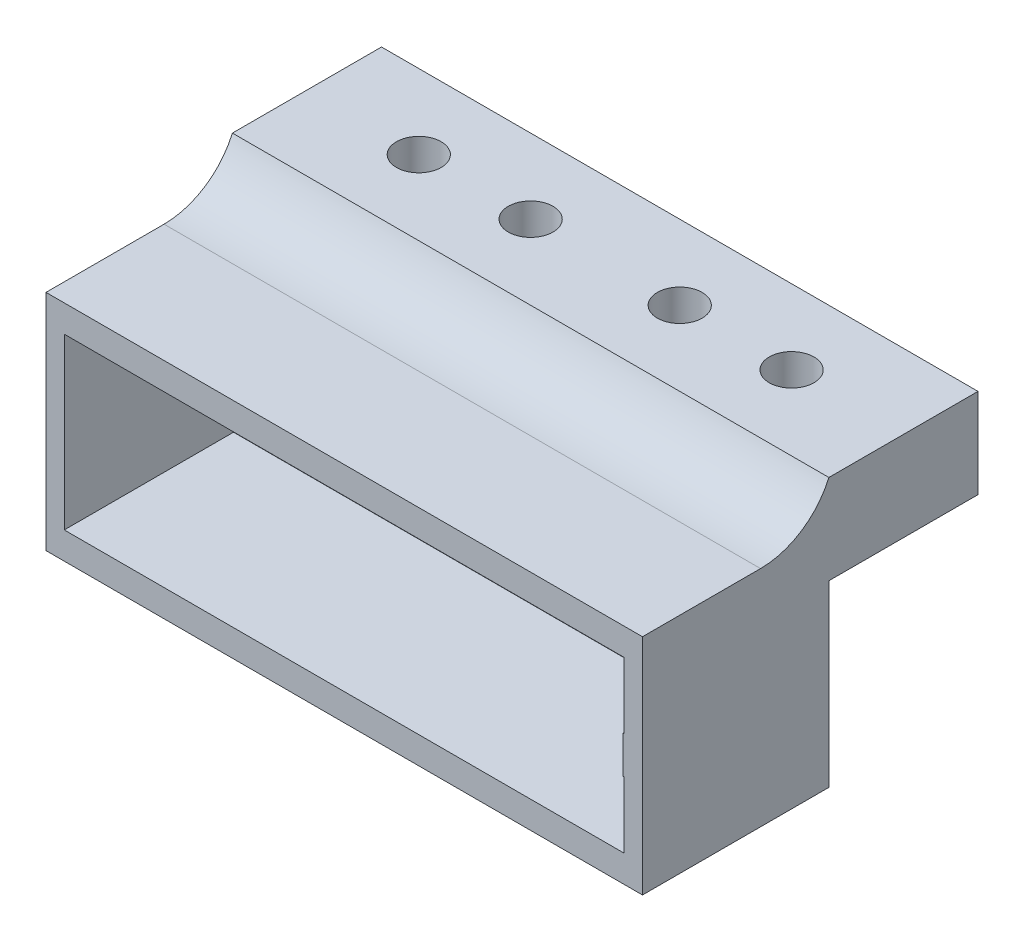
from build123d import *

# Parameters (mm, degrees)
SKETCH1_W                 = 80
SKETCH1_H                 = 30
MOTOR_HOUSING_DEPTH       = 25
SKETCH2_W                 = 80
SKETCH2_H                 = 6
ATATACH_TO_BODY_R_DEPTH   = 20
FILLET_R_R                = 10
SCREW_START               = -12
SKETCH3_R                 = 5.75
SKETCH3_R_2               = 3
SCREW_HEAD_INSETS_R_DEPTH = 1
SKETCH3_2_R               = 3
SCREW_HOLES_R_DEPTH       = 74.569203879
SKETCH4_R                 = 1.5
SKETCH4_R_2               = 2.85
SKETCH4_W                 = 6
SKETCH4_H                 = 14
MOTOR_HOLES_DEPTH         = 96.407286673
SKETCH4_3_R               = 1.5
SKETCH4_3_R_2             = 2.85
SKETCH4_3_W               = 6
SKETCH4_3_H               = 14
MOTOR_CAVITY_DEPTH        = 22.7
SKETCH4_4_W               = 4.8
SKETCH4_4_H               = 5
SKETCH4_4_R               = 1.5
MOUNT_STABILITY_DEPTH     = 16.7


with BuildPart() as part:
    # Sketch1 → Motor Housing (new body)
    with BuildSketch(Plane.XY):
        with Locations((-19.08830476, 38.88424326)):
            Rectangle(SKETCH1_W, SKETCH1_H)
    extrude(amount=MOTOR_HOUSING_DEPTH)

    # Sketch2 → Atatach to Body R (add)
    with BuildSketch(Plane(origin=(0, 0, 0), x_dir=(-1, 0, 0), z_dir=(0, 0, -1))):
        with Locations((19.08830476, 50.88424326)):
            Rectangle(SKETCH2_W, SKETCH2_H)
        with Locations((19.08830476, 56.88424326)):
            Rectangle(SKETCH2_W, SKETCH2_H)
    extrude(amount=ATATACH_TO_BODY_R_DEPTH)

    # Fillet R
    # the kernel refuses this fillet: 10 mm, written as the material it adds along each edge
    with BuildSketch(Plane(origin=(-59.08830476, 53.88424326, 0), x_dir=(0, 0, 1), z_dir=(1, 0, 0))) as fillet_r_piece_1:
        with BuildLine():
            CenterArc((9.16515139, -10), FILLET_R_R, 90, 66.421821522)
            Line((0, -6), (-0.183303028, -5.92))
            ThreePointArc((-0.183303028, -5.92), (-0.2, -3), (-0.2, 0))
            Line((-0.2, 0), (0, 0.2))
            Line((0, 0.2), (9.16515139, 0.2))
            Line((9.16515139, 0.2), (9.16515139, 0))
        make_face()
    extrude(amount=80)

    # Sketch3 → Screw Head Insets R (cut)
    # profile 1 of 4: a face of its own
    with BuildSketch(Plane(origin=(0, 59.88424326, 0), x_dir=(1, 0, 0), z_dir=(0, 1, 0)).offset(SCREW_START)):
        with Locations(Location((-44.08830476, 10, 0), (0, 0, 270))):
            Circle(SKETCH3_R)
        with Locations(Location((-44.08830476, 10, 0), (0, 0, 270))):
            Circle(SKETCH3_R_2, mode=Mode.SUBTRACT)
    # profile 2 of 4: a face of its own
    with BuildSketch(Plane(origin=(0, 59.88424326, 0), x_dir=(1, 0, 0), z_dir=(0, 1, 0)).offset(SCREW_START)):
        with Locations(Location((-29.08830476, 10, 0), (0, 0, 270))):
            Circle(SKETCH3_R)
        with Locations(Location((-29.08830476, 10, 0), (0, 0, 270))):
            Circle(SKETCH3_R_2, mode=Mode.SUBTRACT)
    # profile 3 of 4: a face of its own
    with BuildSketch(Plane(origin=(0, 59.88424326, 0), x_dir=(1, 0, 0), z_dir=(0, 1, 0)).offset(SCREW_START)):
        with Locations(Location((5.91169524, 10, 0), (0, 0, 270))):
            Circle(SKETCH3_R)
        with Locations(Location((5.91169524, 10, 0), (0, 0, 270))):
            Circle(SKETCH3_R_2, mode=Mode.SUBTRACT)
    # profile 4 of 4: a face of its own
    with BuildSketch(Plane(origin=(0, 59.88424326, 0), x_dir=(1, 0, 0), z_dir=(0, 1, 0)).offset(SCREW_START)):
        with Locations(Location((-9.08830476, 10, 0), (0, 0, 270))):
            Circle(SKETCH3_R)
        with Locations(Location((-9.08830476, 10, 0), (0, 0, 270))):
            Circle(SKETCH3_R_2, mode=Mode.SUBTRACT)
    extrude(amount=SCREW_HEAD_INSETS_R_DEPTH, mode=Mode.SUBTRACT)

    # Sketch3<2> → Screw Holes R (cut, through all)
    with BuildSketch(Plane(origin=(0, 59.88424326, 0), x_dir=(1, 0, 0), z_dir=(0, 1, 0))):
        with Locations(Location((5.91169524, 10, 0), (0, 0, 270))):
            Circle(SKETCH3_2_R)
        with Locations(Location((-9.08830476, 10, 0), (0, 0, 270))):
            Circle(SKETCH3_2_R)
        with Locations(Location((-29.08830476, 10, 0), (0, 0, 270))):
            Circle(SKETCH3_2_R)
        with Locations(Location((-44.08830476, 10, 0), (0, 0, 270))):
            Circle(SKETCH3_2_R)
    extrude(amount=-SCREW_HOLES_R_DEPTH, mode=Mode.SUBTRACT)

    # Sketch4 → Motor Holes (cut, through all)
    with BuildSketch(Plane.XY.offset(25)):
        with Locations((-17.93830476, 47.68424326)):
            Circle(SKETCH4_R)
        with Locations((-17.93830476, 30.08424326)):
            Circle(SKETCH4_R)
        with Locations((1.91169524, 38.88424326)):
            Circle(SKETCH4_R_2)
        with Locations((15.91169524, 38.88424326)):
            Circle(SKETCH4_R)
        with Locations((-43.63830476, 38.88424326)):
            Rectangle(SKETCH4_W, SKETCH4_H)
    extrude(amount=-MOTOR_HOLES_DEPTH, mode=Mode.SUBTRACT)

    # Sketch4<3> → Motor Cavity (cut)
    with BuildSketch(Plane.XY.offset(25)):
        Polygon((18.46169524, 50.25424326), (-56.63830476, 50.25424326), (-56.63830476, 27.51424326), (18.46169524, 27.51424326), (18.46169524, 36.38424326), (18.31169524, 36.38424326), (13.51169524, 36.38424326), (13.51169524, 41.38424326), (18.31169524, 41.38424326), (18.46169524, 41.38424326), align=None)
        with Locations((-17.93830476, 30.08424326)):
            Circle(SKETCH4_3_R, mode=Mode.SUBTRACT)
        with Locations((1.91169524, 38.88424326)):
            Circle(SKETCH4_3_R_2, mode=Mode.SUBTRACT)
        with Locations((-43.63830476, 38.88424326)):
            Rectangle(SKETCH4_3_W, SKETCH4_3_H, mode=Mode.SUBTRACT)
        with Locations((-17.93830476, 47.68424326)):
            Circle(SKETCH4_3_R, mode=Mode.SUBTRACT)
    extrude(amount=-MOTOR_CAVITY_DEPTH, mode=Mode.SUBTRACT)

    # Sketch4<4> → Mount Stability (cut)
    with BuildSketch(Plane.XY.offset(25)):
        with Locations((15.91169524, 38.88424326)):
            Rectangle(SKETCH4_4_W, SKETCH4_4_H)
        with Locations((15.91169524, 38.88424326)):
            Circle(SKETCH4_4_R, mode=Mode.SUBTRACT)
    extrude(amount=-MOUNT_STABILITY_DEPTH, mode=Mode.SUBTRACT)


solid = part.part
